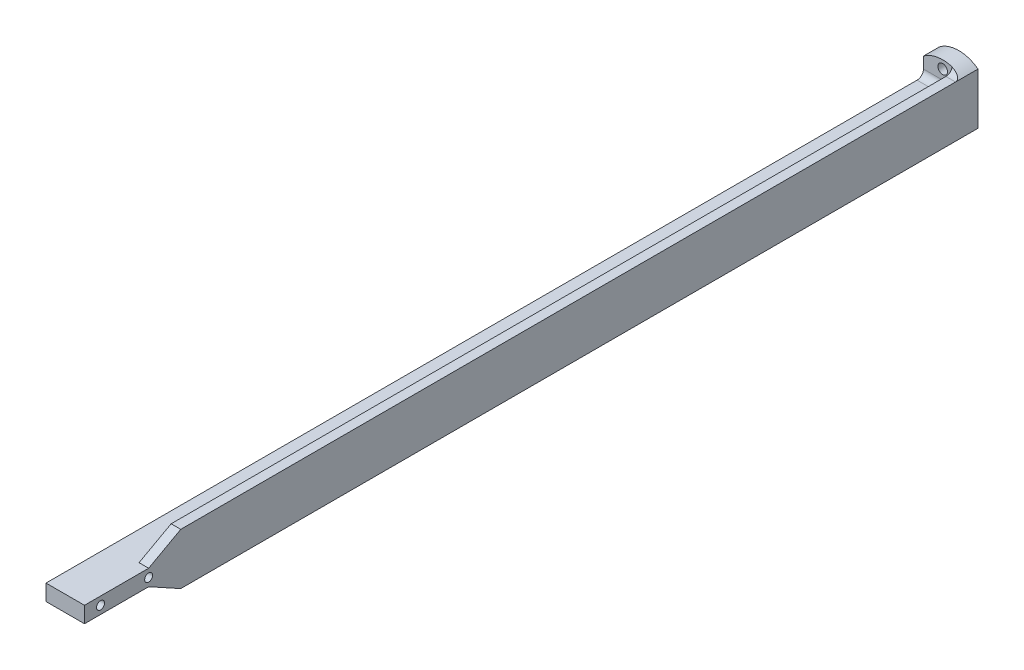
from build123d import *

# Parameters (mm, degrees)
ESQUISSE1_R             = 3
BOSS_EXTRU_1_DEPTH      = 10
BOSS_EXTRU_2_DEPTH      = 547
ENL_V_MAT_EXTRU_1_DEPTH = 558.649531516
CONG_1_R                = 4
ESQUISSE4_R             = 2.5
ENL_V_MAT_EXTRU_2_DEPTH = 12
ENL_V_START             = -12
ESQUISSE4_2_R           = 2.5
ENL_V_MAT_EXTRU_3_DEPTH = 12


with BuildPart() as part:
    # Esquisse1 → Boss.-Extru.1 (new body)
    with BuildSketch(Plane.XY):
        with BuildLine():
            Line((12, 16), (12, -16))
            ThreePointArc((12, -16), (0, -20), (-12, -16))
            Line((-12, -16), (-12, 16))
            ThreePointArc((-12, 16), (0, 20), (12, 16))
        make_face()
        with Locations((0, 15)):
            Circle(ESQUISSE1_R, mode=Mode.SUBTRACT)
        with Locations(Location((0, -15, 0), (0, 0, 180))):
            Circle(ESQUISSE1_R, mode=Mode.SUBTRACT)
    extrude(amount=BOSS_EXTRU_1_DEPTH)

    # Esquisse2 → Boss.-Extru.2 (add)
    with BuildSketch(Plane.XY.offset(10)):
        Polygon((12, 16), (12, -16), (6, -16), (6, -5), (-12, -5), (-12, 5), (6, 5), (6, 16), align=None)
    extrude(amount=BOSS_EXTRU_2_DEPTH)

    # Esquisse3 → Enlèv. mat.-Extru.1 (cut, through all)
    with BuildSketch(Plane.ZY.offset(-6)):
        Polygon((557, 5), (557, 16), (497, 16), (517, 5), align=None)
        Polygon((557, -5), (557, -16), (497, -16), (517, -5), align=None)
    extrude(amount=-ENL_V_MAT_EXTRU_1_DEPTH, mode=Mode.SUBTRACT)

    # Congé1
    # the kernel refuses this fillet: 4 mm, written as the material it adds along each edge
    with BuildSketch(Plane(origin=(6, 16, 10), x_dir=(0, 0, 1), z_dir=(1, 0, 0))) as cong_1_piece_1_section:
        with BuildLine():
            CenterArc((CONG_1_R, -CONG_1_R), CONG_1_R, 90, 90)
            Line((0, -CONG_1_R), (0, 0))
            Line((0, 0), (CONG_1_R, 0))
        make_face()
    cong_1_piece_1 = extrude(amount=16, mode=Mode.PRIVATE)
    cong_1_piece_1 = cong_1_piece_1 & Plane(origin=(0, 0, 11.015044396), x_dir=(-0.6000000000000009, 0.7999999999999994, 0), z_dir=(0, 0, -1)) * Cylinder(20, 48, mode=Mode.PRIVATE)
    add(cong_1_piece_1)
    with BuildSketch(Plane(origin=(-12, 5, 10), x_dir=(0, 1, 0), z_dir=(1, 0, 0))) as cong_1_piece_2:
        with BuildLine():
            CenterArc((CONG_1_R, CONG_1_R), CONG_1_R, 180, 90)
            Line((0, CONG_1_R), (0, 0))
            Line((0, 0), (CONG_1_R, 0))
        make_face()
    extrude(amount=18)
    with BuildSketch(Plane(origin=(6, -5, 10), x_dir=(0, 0, 1), z_dir=(-1, 0, 0))) as cong_1_piece_3:
        with BuildLine():
            CenterArc((CONG_1_R, -CONG_1_R), CONG_1_R, 90, 90)
            Line((0, -CONG_1_R), (0, 0))
            Line((0, 0), (CONG_1_R, 0))
        make_face()
    extrude(amount=18)
    with BuildSketch(Plane(origin=(22, -16, 10), x_dir=(0, 0, 1), z_dir=(-1, 0, 0))) as cong_1_piece_4_section:
        with BuildLine():
            CenterArc((CONG_1_R, -CONG_1_R), CONG_1_R, 90, 90)
            Line((0, -CONG_1_R), (0, 0))
            Line((0, 0), (CONG_1_R, 0))
        make_face()
    cong_1_piece_4 = extrude(amount=16, mode=Mode.PRIVATE)
    cong_1_piece_4 = cong_1_piece_4 & Plane(origin=(0, 0, 11.015045295), x_dir=(0.5999999999999954, -0.8000000000000034, 0), z_dir=(0, 0, -1)) * Cylinder(20, 48, mode=Mode.PRIVATE)
    add(cong_1_piece_4)

    # Esquisse4 → Enlèv. mat.-Extru.2 (cut)
    with BuildSketch(Plane.ZY.offset(12)):
        with Locations((547, 0)):
            Circle(ESQUISSE4_R)
        with Locations((517, 0)):
            Circle(ESQUISSE4_R)
    extrude(amount=-ENL_V_MAT_EXTRU_2_DEPTH, mode=Mode.SUBTRACT)

    # Esquisse4<2> → Enlèv. mat.-Extru.3 (cut)
    with BuildSketch(Plane.ZY.offset(12).offset(ENL_V_START)):
        with Locations((547, 0)):
            Circle(ESQUISSE4_2_R)
        with Locations((517, 0)):
            Circle(ESQUISSE4_2_R)
    extrude(amount=-ENL_V_MAT_EXTRU_3_DEPTH, mode=Mode.SUBTRACT)


solid = part.part
